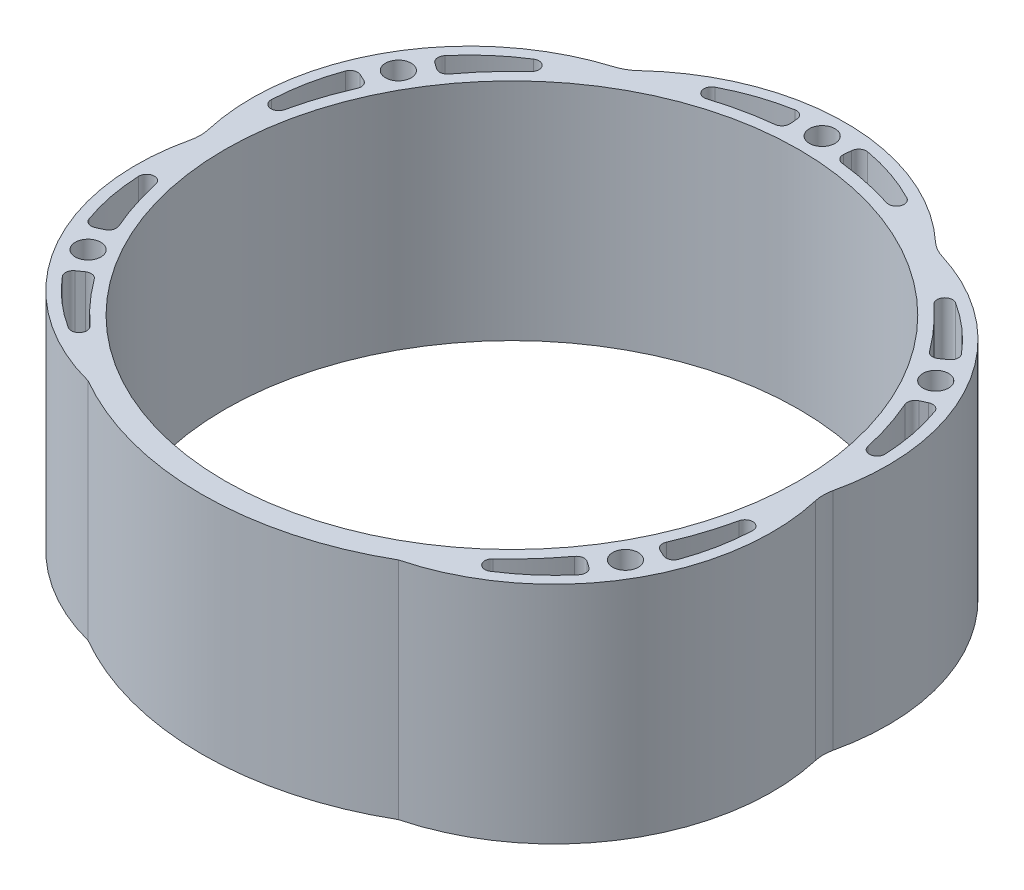
from build123d import *

# Parameters (mm, degrees)
SWEEP_2_DEPTH                   = 3
SKETCH_15_W                     = 3
SKETCH_15_H                     = 8
SKETCH_17_W                     = 3
SKETCH_17_H                     = 8
REVOLVE_1_ANGLE                 = 60
SKETCH_20_R                     = 26.546275206
EXTRUDE_1_DEPTH                 = 3
SKETCH_21_R                     = 12.5
CUT_EXTRUDE_1_DEPTH             = 10
CUT_EXTRUDE_2_REACH             = 67.765
SKETCH_22_R                     = 20
EXTRUDE_START                   = 22
SKETCH_23_R                     = 17
SKETCH_23_R_2                   = 12.5
EXTRUDE_2_DEPTH                 = 22
SKETCH_24_R                     = 55.165528931
CUT_EXTRUDE_3_DEPTH             = 70.166465863
SKETCH_25_R                     = 1.4
CUT_EXTRUDE_4_DEPTH             = 10
SKETCH_26_R                     = 3
EXTRUDE_3_DEPTH                 = 3
SKETCH_27_R                     = 1.65
CUT_EXTRUDE_5_DEPTH             = 3
SKETCH_28_R                     = 37
CUT_EXTRUDE_6_DEPTH             = 10
FILLET_1_R                      = 10
SKETCH_29_W                     = 24
SKETCH_29_H                     = 3
EXTRUDE_4_DEPTH                 = 15
SKETCH_30_R                     = 3
EXTRUDE_5_DEPTH                 = 3
SKETCH_31_R                     = 1.25
CUT_EXTRUDE_7_DEPTH             = 3
CUT_EXTRUDE_START               = -10
SKETCH_32_R                     = 1.25
CUT_EXTRUDE_8_DEPTH             = 10
SKETCH_33_R                     = 37
SKETCH_33_R_2                   = 1.65
EXTRUDE_6_DEPTH                 = 26
FILLET_2_R                      = 2
EXTRUDE_START_2                 = -29
EXTRUDE_7_DEPTH                 = 29
PATTERN_CIRCULAR_3_COUNT        = 3
PATTERN_CIRCULAR_3_ANGLE        = 120
MIRROR_START                    = -29
MIRROR_1_COPY_1_DEPTH           = 29
MIRROR_1_COPY_2_DEPTH           = 29
MIRROR_1_COPY_3_DEPTH           = 29
CUT_EXTRUDE_9_DEPTH             = 67.116367792
PATTERN_CIRCULAR_4_COUNT        = 3
PATTERN_CIRCULAR_4_ANGLE        = 120
PATTERN_CIRCULAR_4_COPY_1_DEPTH = 67.116367792
PATTERN_CIRCULAR_4_COPY_2_DEPTH = 67.116367792
MIRROR_3_COPY_1_DEPTH           = 67.116367792
MIRROR_3_COPY_2_DEPTH           = 67.116367792
MIRROR_3_COPY_3_DEPTH           = 67.116367792
MIRROR_3_COPY_4_DEPTH           = 67.116367792
MIRROR_3_COPY_5_DEPTH           = 67.116367792
FILLET_4_R                      = 1
FILLET_5_R                      = 1
EXTRUDE_8_DEPTH                 = 29
PATTERN_CIRCULAR_5_COUNT        = 3
PATTERN_CIRCULAR_5_ANGLE        = 120
PATTERN_CIRCULAR_5_COPY_1_DEPTH = 29
PATTERN_CIRCULAR_5_COPY_2_DEPTH = 29
F_5_THE_OTHER_WAY_COUNT         = 3
F_5_THE_OTHER_WAY_ANGLE         = 120
F_5_THE_OTHER_WAY_COPY_1_DEPTH  = 29
F_5_THE_OTHER_WAY_COPY_2_DEPTH  = 29
FILLET_6_R                      = 5


# Read off the part's stored shape, not the designer's step: 扫描2
with BuildPart() as part:
    # 扫描2 outline → 扫描2 (new body)
    with BuildSketch(Plane(origin=(0, 0, 0), x_dir=(1, 0, 0), z_dir=(0, 1, 0))):
        with BuildLine():
            ThreePointArc((-20, -34.641016151), (-12.679491924, -41.961524227), (-10, -51.961524227))
            Line((-10, -51.961524227), (11, -51.961524227))
            ThreePointArc((11, -51.961524227), (10.470745096, -45.395034193), (8.896644323, -38.998073283))
            ThreePointArc((8.896644323, -38.998073283), (5.963817028, 39.55291249), (-20, -34.641016151))
        make_face()
        with BuildLine():
            ThreePointArc((0, -24.015147002), (-4.46857992, -19.881209566), (-9.5, -16.454482672))
            ThreePointArc((-9.5, -16.454482672), (4.917561857, 18.352590699), (0, -19))
            Line((0, -19), (0, -24.015147002))
        make_face(mode=Mode.SUBTRACT)
    extrude(amount=SWEEP_2_DEPTH)

    # 扫描3: sweep along a path in 草图16
    with BuildLine(Plane(origin=(0, 3, 0), x_dir=(1, 0, 0), z_dir=(0, 1, 0))) as sweep_3_path:
        ThreePointArc((-10, -51.961524227), (-12.679491924, -41.961524227), (-20, -34.641016151))
        ThreePointArc((-20, -34.641016151), (5.963817027, 39.55291249), (8.896644323, -38.998073283))
    # 草图15 → 扫描3 (sweep)
    with BuildSketch(Plane.XY.offset(51.961524227)):
        with Locations((-8.5, 4)):
            Rectangle(SKETCH_15_W, SKETCH_15_H)
    sweep(path=sweep_3_path.line)

    # 草图17 → 旋转1 (revolve)
    with BuildSketch(Plane.XY.offset(51.961524227)):
        with Locations((12.5, 4)):
            Rectangle(SKETCH_17_W, SKETCH_17_H)
    revolve(axis=Axis((-30, 3, 51.961524227), (0, 1, 0)), revolution_arc=REVOLVE_1_ANGLE)

    # 草图20 → 凸台-拉伸1 (add)
    with BuildSketch(Plane(origin=(0, 3, 0), x_dir=(1, 0, 0), z_dir=(0, 1, 0))):
        Circle(SKETCH_20_R)
    extrude(amount=-EXTRUDE_1_DEPTH)

    # 草图21 → 切除-拉伸1 (cut)
    with BuildSketch(Plane(origin=(0, 3, 0), x_dir=(1, 0, 0), z_dir=(0, 1, 0))):
        with Locations(Location((0, 0, 0), (0, 0, 270))):
            Circle(SKETCH_21_R)
    extrude(amount=-CUT_EXTRUDE_1_DEPTH, mode=Mode.SUBTRACT)

    # 草图22 → 切除-拉伸2 (cut, up to next)
    with BuildSketch(Plane(origin=(0, 3, 0), x_dir=(1, 0, 0), z_dir=(0, 1, 0)), mode=Mode.PRIVATE) as cut_extrude_2_sk1:
        Circle(SKETCH_22_R)
    cut_extrude_2_tool1 = extrude(cut_extrude_2_sk1.sketch, amount=CUT_EXTRUDE_2_REACH, mode=Mode.PRIVATE) & part.part
    add(cut_extrude_2_tool1.solids().sort_by_distance((0, 3, 0))[0], mode=Mode.SUBTRACT)

    # 草图23 → 凸台-拉伸2 (add)
    with BuildSketch(Plane(origin=(0, 3, 0), x_dir=(1, 0, 0), z_dir=(0, 1, 0)).offset(EXTRUDE_START)):
        with Locations(Location((0, 0, 0), (0, 0, 270))):
            Circle(SKETCH_23_R)
        with Locations(Location((0, 0, 0), (0, 0, 270))):
            Circle(SKETCH_23_R_2, mode=Mode.SUBTRACT)
    extrude(amount=-EXTRUDE_2_DEPTH)

    # 草图24 → 切除-拉伸3 (cut, through all)
    with BuildSketch(Plane(origin=(0, 3, 0), x_dir=(1, 0, 0), z_dir=(0, 1, 0))):
        Circle(SKETCH_24_R)
    extrude(amount=CUT_EXTRUDE_3_DEPTH, mode=Mode.SUBTRACT)

    # 草图25 → 切除-拉伸4 (cut)
    with BuildSketch(Plane(origin=(0, 3, 0), x_dir=(1, 0, 0), z_dir=(0, 1, 0))):
        with Locations(Location((0, -14.75, 0), (0, 0, 270))):
            Circle(SKETCH_25_R)
        with Locations(Location((-12.773874706, 7.375, 0), (0, 0, 270))):
            Circle(SKETCH_25_R)
        with Locations(Location((12.773874706, 7.375, 0), (0, 0, 270))):
            Circle(SKETCH_25_R)
    extrude(amount=-CUT_EXTRUDE_4_DEPTH, mode=Mode.SUBTRACT)

    # 草图26 → 凸台-拉伸3 (add)
    with BuildSketch(Plane(origin=(0, 3, 0), x_dir=(1, 0, 0), z_dir=(0, 1, 0))):
        with Locations((0, 40)):
            Circle(SKETCH_26_R)
        with Locations((34.641016151, 20)):
            Circle(SKETCH_26_R)
        with Locations((34.641016151, -20)):
            Circle(SKETCH_26_R)
        with Locations((0, -40)):
            Circle(SKETCH_26_R)
        with Locations((-34.641016151, -20)):
            Circle(SKETCH_26_R)
        with Locations((-34.641016151, 20)):
            Circle(SKETCH_26_R)
    extrude(amount=-EXTRUDE_3_DEPTH)

    # 草图27 → 切除-拉伸5 (cut)
    with BuildSketch(Plane(origin=(0, 3, 0), x_dir=(1, 0, 0), z_dir=(0, 1, 0))):
        with Locations(Location((0, 40, 0), (0, 0, 270))):
            Circle(SKETCH_27_R)
        with Locations(Location((34.641016151, 20, 0), (0, 0, 270))):
            Circle(SKETCH_27_R)
        with Locations(Location((34.641016151, -20, 0), (0, 0, 270))):
            Circle(SKETCH_27_R)
        with Locations(Location((-34.641016151, -20, 0), (0, 0, 270))):
            Circle(SKETCH_27_R)
        with Locations(Location((-34.641016151, 20, 0), (0, 0, 270))):
            Circle(SKETCH_27_R)
    extrude(amount=-CUT_EXTRUDE_5_DEPTH, mode=Mode.SUBTRACT)

    # 草图28 → 切除-拉伸6 (cut)
    with BuildSketch(Plane.XZ):
        with Locations(Location((0, 0, 0), (0, 0, 270))):
            Circle(SKETCH_28_R)
    extrude(amount=-CUT_EXTRUDE_6_DEPTH, mode=Mode.SUBTRACT)

    # 圆角1
    fillet_1_edges = [part.edges().sort_by_distance(p)[0] for p in [
        (11.799212586, 1.5, 38.220133207),
    ]]
    fillet(fillet_1_edges, radius=FILLET_1_R)

    # 草图29 → 凸台-拉伸4 (add)
    with BuildSketch(Plane.XY.offset(51.961524227)):
        with Locations((2, 1.5)):
            Rectangle(SKETCH_29_W, SKETCH_29_H)
    extrude(amount=EXTRUDE_4_DEPTH)

    # 草图30 → 凸台-拉伸5 (add)
    with BuildSketch(Plane.XZ):
        with Locations((-10, 54.961524227)):
            Circle(SKETCH_30_R)
        with Locations((14, 54.961524227)):
            Circle(SKETCH_30_R)
    extrude(amount=-EXTRUDE_5_DEPTH)

    # 草图31 → 切除-拉伸7 (cut)
    with BuildSketch(Plane.XZ):
        with Locations(Location((14, 54.961524227, 0), (0, 0, 270))):
            Circle(SKETCH_31_R)
        with Locations(Location((-10, 54.961524227, 0), (0, 0, 270))):
            Circle(SKETCH_31_R)
    extrude(amount=-CUT_EXTRUDE_7_DEPTH, mode=Mode.SUBTRACT)

    # 草图32 → 切除-拉伸8 (cut)
    with BuildSketch(Plane(origin=(0, 3, 0), x_dir=(1, 0, 0), z_dir=(0, 1, 0)).offset(CUT_EXTRUDE_START)):
        with BuildLine():
            Line((-10, -66.961524227), (14, -66.961524227))
            Line((14, -66.961524227), (14, -57.961524227))
            ThreePointArc((14, -57.961524227), (17, -54.961524227), (14, -51.961524227))
            ThreePointArc((14, -51.961524227), (13.884685063, -48.778064325), (13.539344684, -45.611290809))
            ThreePointArc((13.539344684, -45.611290809), (14.514796568, -39.647413342), (18.747720235, -35.334444753))
            ThreePointArc((18.747720235, -35.334444753), (-0.715724778, -39.993596213), (-20, -34.641016151))
            ThreePointArc((-20, -34.641016151), (-12.679491924, -41.961524227), (-10, -51.961524227))
            ThreePointArc((-10, -51.961524227), (-13, -54.961524227), (-10, -57.961524227))
            Line((-10, -57.961524227), (-10, -66.961524227))
        make_face()
        with Locations((-10, -54.961524227)):
            Circle(SKETCH_32_R, mode=Mode.SUBTRACT)
        with Locations((14, -54.961524227)):
            Circle(SKETCH_32_R, mode=Mode.SUBTRACT)
    extrude(amount=CUT_EXTRUDE_8_DEPTH, mode=Mode.SUBTRACT)

    # 草图33 → 凸台-拉伸6 (add)
    with BuildSketch(Plane(origin=(0, 3, 0), x_dir=(1, 0, 0), z_dir=(0, 1, 0))):
        with BuildLine():
            ThreePointArc((-33.044643352, -22.539998796), (0, -40), (33.044643352, -22.539998796))
            ThreePointArc((33.044643352, -22.539998796), (37.239092363, -21.5), (36.042533235, -17.347501204))
            ThreePointArc((36.042533235, -17.347501204), (40, 0), (36.042533235, 17.347501204))
            ThreePointArc((36.042533235, 17.347501204), (37.239092363, 21.5), (33.044643352, 22.539998796))
            ThreePointArc((33.044643352, 22.539998796), (20, 34.641016151), (2.997889883, 39.8875))
            ThreePointArc((2.997889883, 39.8875), (0, 43), (-2.997889883, 39.8875))
            ThreePointArc((-2.997889883, 39.8875), (-20, 34.641016151), (-33.044643352, 22.539998796))
            ThreePointArc((-33.044643352, 22.539998796), (-37.239092363, 21.5), (-36.042533235, 17.347501204))
            ThreePointArc((-36.042533235, 17.347501204), (-40, 0), (-36.042533235, -17.347501204))
            ThreePointArc((-36.042533235, -17.347501204), (-37.239092363, -21.5), (-33.044643352, -22.539998796))
        make_face()
        with Locations(Location((0, 0, 0), (0, 0, 90))):
            Circle(SKETCH_33_R, mode=Mode.SUBTRACT)
        with Locations(Location((-34.641016151, -20, 0), (0, 0, 270))):
            Circle(SKETCH_33_R_2, mode=Mode.SUBTRACT)
        with Locations(Location((34.641016151, -20, 0), (0, 0, 270))):
            Circle(SKETCH_33_R_2, mode=Mode.SUBTRACT)
        with Locations(Location((0, 40, 0), (0, 0, 270))):
            Circle(SKETCH_33_R_2, mode=Mode.SUBTRACT)
        with Locations(Location((34.641016151, 20, 0), (0, 0, 270))):
            Circle(SKETCH_33_R_2, mode=Mode.SUBTRACT)
        with Locations(Location((-34.641016151, 20, 0), (0, 0, 270))):
            Circle(SKETCH_33_R_2, mode=Mode.SUBTRACT)
    extrude(amount=EXTRUDE_6_DEPTH)

    # 圆角2
    fillet_2_edges = [part.edges().sort_by_distance(p)[0] for p in [
        (33.044643352, 16, -22.539998796),
        (36.042533235, 16, -17.347501204),
        (36.042533235, 16, 17.347501204),
        (33.044643352, 16, 22.539998796),
        (-2.997889883, 16, -39.8875),
        (2.997889883, 16, -39.8875),
        (-36.042533235, 16, -17.347501204),
        (-33.044643352, 16, -22.539998796),
        (-33.044643352, 16, 22.539998796),
        (-36.042533235, 16, 17.347501204),
    ]]
    fillet(fillet_2_edges, radius=FILLET_2_R)

    # 草图34 → 凸台-拉伸7 (add)
    with BuildSketch(Plane(origin=(0, 29, 0), x_dir=(1, 0, 0), z_dir=(0, 1, 0)).offset(EXTRUDE_START_2)):
        with BuildLine():
            ThreePointArc((2.7e-08, 43), (-10.838272578, 40.826188689), (-20, 34.641016151))
            ThreePointArc((-20, 34.641016151), (-12.496448765, 37.997878471), (-4.465142775, 39.75))
            ThreePointArc((-4.465142775, 39.75), (-3.456049517, 40.162281761), (-2.813039948, 41.0425))
            ThreePointArc((-2.813039948, 41.0425), (-1.713548938, 42.462468282), (2.7e-08, 43))
        make_face()
        with BuildLine():
            ThreePointArc((4.465142775, 39.75), (12.496448765, 37.997878471), (20, 34.641016151))
            ThreePointArc((20, 34.641016151), (10.838272603, 40.826188679), (2.7e-08, 43))
            ThreePointArc((2.7e-08, 43), (1.71354896, 42.462468266), (2.813039948, 41.0425))
            ThreePointArc((2.813039948, 41.0425), (3.456049517, 40.162281761), (4.465142775, 39.75))
        make_face()
    extrude_7 = extrude(amount=EXTRUDE_7_DEPTH)

    # 阵列(圆周)3: 凸台-拉伸7 ×3 about axis
    pattern_circular_3_axis = Axis((0, 0, 0), (0, 1, 0))
    for i in range(1, PATTERN_CIRCULAR_3_COUNT):
        add(extrude_7.rotate(pattern_circular_3_axis, i * PATTERN_CIRCULAR_3_ANGLE / (PATTERN_CIRCULAR_3_COUNT - 1)))

    # 镜向1 copy 1 sketch → 镜向1 copy 1 (add)
    with BuildSketch(Plane(origin=(0, 29, 0), x_dir=(-0.499999999999998, 0, -0.8660254037844398), z_dir=(0, 1, 0)).offset(MIRROR_START)):
        with BuildLine():
            ThreePointArc((2.7e-08, -43), (-10.838272578, -40.826188689), (-20, -34.641016151))
            ThreePointArc((-20, -34.641016151), (-12.496448765, -37.997878471), (-4.465142775, -39.75))
            ThreePointArc((-4.465142775, -39.75), (-3.456049517, -40.162281761), (-2.813039948, -41.0425))
            ThreePointArc((-2.813039948, -41.0425), (-1.713548938, -42.462468282), (2.7e-08, -43))
        make_face()
        with BuildLine():
            ThreePointArc((4.465142775, -39.75), (12.496448765, -37.997878471), (20, -34.641016151))
            ThreePointArc((20, -34.641016151), (10.838272603, -40.826188679), (2.7e-08, -43))
            ThreePointArc((2.7e-08, -43), (1.71354896, -42.462468266), (2.813039948, -41.0425))
            ThreePointArc((2.813039948, -41.0425), (3.456049517, -40.162281761), (4.465142775, -39.75))
        make_face()
    extrude(amount=MIRROR_1_COPY_1_DEPTH)

    # 镜向1 copy 2 sketch → 镜向1 copy 2 (add)
    with BuildSketch(Plane(origin=(0, 29, 0), x_dir=(0.500000000000004, 0, -0.8660254037844363), z_dir=(0, 1, 0)).offset(MIRROR_START)):
        with BuildLine():
            ThreePointArc((2.7e-08, -43), (-10.838272578, -40.826188689), (-20, -34.641016151))
            ThreePointArc((-20, -34.641016151), (-12.496448765, -37.997878471), (-4.465142775, -39.75))
            ThreePointArc((-4.465142775, -39.75), (-3.456049517, -40.162281761), (-2.813039948, -41.0425))
            ThreePointArc((-2.813039948, -41.0425), (-1.713548938, -42.462468282), (2.7e-08, -43))
        make_face()
        with BuildLine():
            ThreePointArc((4.465142775, -39.75), (12.496448765, -37.997878471), (20, -34.641016151))
            ThreePointArc((20, -34.641016151), (10.838272603, -40.826188679), (2.7e-08, -43))
            ThreePointArc((2.7e-08, -43), (1.71354896, -42.462468266), (2.813039948, -41.0425))
            ThreePointArc((2.813039948, -41.0425), (3.456049517, -40.162281761), (4.465142775, -39.75))
        make_face()
    extrude(amount=MIRROR_1_COPY_2_DEPTH)

    # 镜向1 copy 3 sketch → 镜向1 copy 3 (add)
    with BuildSketch(Plane(origin=(0, 29, 0), x_dir=(-1, 0, 0), z_dir=(0, 1, 0)).offset(MIRROR_START)):
        with BuildLine():
            ThreePointArc((2.7e-08, -43), (-10.838272578, -40.826188689), (-20, -34.641016151))
            ThreePointArc((-20, -34.641016151), (-12.496448765, -37.997878471), (-4.465142775, -39.75))
            ThreePointArc((-4.465142775, -39.75), (-3.456049517, -40.162281761), (-2.813039948, -41.0425))
            ThreePointArc((-2.813039948, -41.0425), (-1.713548938, -42.462468282), (2.7e-08, -43))
        make_face()
        with BuildLine():
            ThreePointArc((4.465142775, -39.75), (12.496448765, -37.997878471), (20, -34.641016151))
            ThreePointArc((20, -34.641016151), (10.838272603, -40.826188679), (2.7e-08, -43))
            ThreePointArc((2.7e-08, -43), (1.71354896, -42.462468266), (2.813039948, -41.0425))
            ThreePointArc((2.813039948, -41.0425), (3.456049517, -40.162281761), (4.465142775, -39.75))
        make_face()
    extrude(amount=MIRROR_1_COPY_3_DEPTH)

    # 草图35 → 切除-拉伸9 (cut, through all)
    with BuildSketch(Plane(origin=(0, 29, 0), x_dir=(1, 0, 0), z_dir=(0, 1, 0))):
        with BuildLine():
            ThreePointArc((-16.270803077, 34.892849801), (-9.964533236, 37.188144312), (-3.355496096, 38.353495877))
            Line((-3.355496096, 38.353495877), (-3.616963324, 41.342079971))
            ThreePointArc((-3.616963324, 41.342079971), (-10.52155438, 39.427235786), (-16.668082722, 35.744818749))
            Line((-16.668082722, 35.744818749), (-16.270803077, 34.892849801))
        make_face()
    cut_extrude_9 = extrude(amount=-CUT_EXTRUDE_9_DEPTH, mode=Mode.SUBTRACT)

    # 镜向2: 切除-拉伸9 across plane
    add(cut_extrude_9.mirror(Plane(origin=(0, 0, 0), x_dir=(0, 0, 1), z_dir=(1, 0, 0))), mode=Mode.SUBTRACT)

    # 阵列(圆周)4: 切除-拉伸9 ×3 about axis
    pattern_circular_4_axis = Axis((0, 0, 0), (0, 1, 0))
    for i in range(1, PATTERN_CIRCULAR_4_COUNT):
        add(cut_extrude_9.rotate(pattern_circular_4_axis, i * PATTERN_CIRCULAR_4_ANGLE / (PATTERN_CIRCULAR_4_COUNT - 1)), mode=Mode.SUBTRACT)

    # 阵列(圆周)4 copy 1 sketch → 阵列(圆周)4 copy 1 (cut, through all)
    with BuildSketch(Plane(origin=(0, 29, 0), x_dir=(-0.4999999999999978, 0, 0.8660254037844399), z_dir=(0, 1, 0))):
        with BuildLine():
            ThreePointArc((-16.270803077, -34.892849801), (-9.964533236, -37.188144312), (-3.355496096, -38.353495877))
            Line((-3.355496096, -38.353495877), (-3.616963324, -41.342079971))
            ThreePointArc((-3.616963324, -41.342079971), (-10.52155438, -39.427235786), (-16.668082722, -35.744818749))
            Line((-16.668082722, -35.744818749), (-16.270803077, -34.892849801))
        make_face()
    extrude(amount=-PATTERN_CIRCULAR_4_COPY_1_DEPTH, mode=Mode.SUBTRACT)

    # 阵列(圆周)4 copy 2 sketch → 阵列(圆周)4 copy 2 (cut, through all)
    with BuildSketch(Plane(origin=(0, 29, 0), x_dir=(0.5000000000000044, 0, 0.866025403784436), z_dir=(0, 1, 0))):
        with BuildLine():
            ThreePointArc((-16.270803077, -34.892849801), (-9.964533236, -37.188144312), (-3.355496096, -38.353495877))
            Line((-3.355496096, -38.353495877), (-3.616963324, -41.342079971))
            ThreePointArc((-3.616963324, -41.342079971), (-10.52155438, -39.427235786), (-16.668082722, -35.744818749))
            Line((-16.668082722, -35.744818749), (-16.270803077, -34.892849801))
        make_face()
    extrude(amount=-PATTERN_CIRCULAR_4_COPY_2_DEPTH, mode=Mode.SUBTRACT)

    # 镜向3 copy 1 sketch → 镜向3 copy 1 (cut, through all)
    with BuildSketch(Plane(origin=(0, 29, 0), x_dir=(-0.4999999999999978, 0, -0.8660254037844399), z_dir=(0, 1, 0))):
        with BuildLine():
            ThreePointArc((-16.270803077, -34.892849801), (-9.964533236, -37.188144312), (-3.355496096, -38.353495877))
            Line((-3.355496096, -38.353495877), (-3.616963324, -41.342079971))
            ThreePointArc((-3.616963324, -41.342079971), (-10.52155438, -39.427235786), (-16.668082722, -35.744818749))
            Line((-16.668082722, -35.744818749), (-16.270803077, -34.892849801))
        make_face()
    extrude(amount=-MIRROR_3_COPY_1_DEPTH, mode=Mode.SUBTRACT)

    # 镜向3 copy 2 sketch → 镜向3 copy 2 (cut, through all)
    with BuildSketch(Plane(origin=(0, 29, 0), x_dir=(0.5000000000000044, 0, -0.866025403784436), z_dir=(0, 1, 0))):
        with BuildLine():
            ThreePointArc((-16.270803077, -34.892849801), (-9.964533236, -37.188144312), (-3.355496096, -38.353495877))
            Line((-3.355496096, -38.353495877), (-3.616963324, -41.342079971))
            ThreePointArc((-3.616963324, -41.342079971), (-10.52155438, -39.427235786), (-16.668082722, -35.744818749))
            Line((-16.668082722, -35.744818749), (-16.270803077, -34.892849801))
        make_face()
    extrude(amount=-MIRROR_3_COPY_2_DEPTH, mode=Mode.SUBTRACT)

    # 镜向3 copy 3 sketch → 镜向3 copy 3 (cut, through all)
    with BuildSketch(Plane(origin=(0, 29, 0), x_dir=(0.4999999999999978, 0, 0.8660254037844399), z_dir=(0, 1, 0))):
        with BuildLine():
            ThreePointArc((-16.270803077, 34.892849801), (-9.964533236, 37.188144312), (-3.355496096, 38.353495877))
            Line((-3.355496096, 38.353495877), (-3.616963324, 41.342079971))
            ThreePointArc((-3.616963324, 41.342079971), (-10.52155438, 39.427235786), (-16.668082722, 35.744818749))
            Line((-16.668082722, 35.744818749), (-16.270803077, 34.892849801))
        make_face()
    extrude(amount=-MIRROR_3_COPY_3_DEPTH, mode=Mode.SUBTRACT)

    # 镜向3 copy 4 sketch → 镜向3 copy 4 (cut, through all)
    with BuildSketch(Plane(origin=(0, 29, 0), x_dir=(-0.5000000000000044, 0, 0.866025403784436), z_dir=(0, 1, 0))):
        with BuildLine():
            ThreePointArc((-16.270803077, 34.892849801), (-9.964533236, 37.188144312), (-3.355496096, 38.353495877))
            Line((-3.355496096, 38.353495877), (-3.616963324, 41.342079971))
            ThreePointArc((-3.616963324, 41.342079971), (-10.52155438, 39.427235786), (-16.668082722, 35.744818749))
            Line((-16.668082722, 35.744818749), (-16.270803077, 34.892849801))
        make_face()
    extrude(amount=-MIRROR_3_COPY_4_DEPTH, mode=Mode.SUBTRACT)

    # 镜向3 copy 5 sketch → 镜向3 copy 5 (cut, through all)
    with BuildSketch(Plane(origin=(0, 29, 0), x_dir=(-1, 0, 0), z_dir=(0, 1, 0))):
        with BuildLine():
            ThreePointArc((-16.270803077, -34.892849801), (-9.964533236, -37.188144312), (-3.355496096, -38.353495877))
            Line((-3.355496096, -38.353495877), (-3.616963324, -41.342079971))
            ThreePointArc((-3.616963324, -41.342079971), (-10.52155438, -39.427235786), (-16.668082722, -35.744818749))
            Line((-16.668082722, -35.744818749), (-16.270803077, -34.892849801))
        make_face()
    extrude(amount=-MIRROR_3_COPY_5_DEPTH, mode=Mode.SUBTRACT)

    # 圆角4
    # the kernel refuses this fillet: 1 mm, written as the material it adds along each edge
    with BuildSketch(Plane(origin=(34.892849801, 29, 16.270803077), x_dir=(0.4111112269100741, 0, -0.9115851902639125), z_dir=(0, -1, 0)), Plane(origin=(31.537353705, 29, -22.0826928), x_dir=(-0.5839003190271824, 0, -0.811825361417069), z_dir=(0, -1, 0)), Plane(origin=(-3.355496096, 29, -38.353495877), x_dir=(-0.9950115459372554, 0, 0.09975982884685211), z_dir=(0, -1, 0))) as fillet_4_piece_1:
        with BuildLine():
            CenterArc((0.987420896, 0.999919869), FILLET_4_R, 180.725340527, 88.549318946)
            Line((-0.012498973, 0.987260626), (0, 0))
            ThreePointArc((0, 0), (0.487380827, 0.00308506), (0.974761653, 0))
        make_face()
    extrude(amount=29)
    with BuildSketch(Plane(origin=(37.611773162, 29, 17.538657862), x_dir=(-0.9063077870366464, 0, -0.4226182617407072), z_dir=(0, -1, 0))) as fillet_4_piece_2:
        with BuildLine():
            CenterArc((1.071397567, 1), FILLET_4_R, 174.86854017, 95.13145983)
            ThreePointArc((0.075405462, 1.089441187), (0.03213106, 0.545106236), (0, 0))
            Line((0, 0), (1.071397567, 0))
        make_face()
    extrude(amount=29)
    with BuildSketch(Plane(origin=(39.289962451, 29, 3.437426305), x_dir=(-0.996194698091714, 0, -0.0871557427480193), z_dir=(0, -1, 0)), Plane(origin=(22.621879729, 29, -32.307392444), x_dir=(-0.5735764363513369, 0, 0.8191520442887881), z_dir=(0, -1, 0)), Plane(origin=(-16.668082722, 29, -35.744818749), x_dir=(0.422618261740378, 0, 0.9063077870367998), z_dir=(0, -1, 0))) as fillet_4_piece_3:
        with BuildLine():
            CenterArc((0.798666678, -1), FILLET_4_R, 90, 78.108408666)
            ThreePointArc((-0.179872559, -0.793939422), (-0.09296294, -0.396284), (0, 0))
            Line((0, 0), (0.798666678, 0))
        make_face()
    extrude(amount=29)
    with BuildSketch(Plane(origin=(38.353495877, 29, 3.355496096), x_dir=(0.9961946980917556, 0, 0.0871557427475427), z_dir=(0, -1, 0)), Plane(origin=(34.892849801, 29, -16.270803077), x_dir=(0.9063077870368025, 0, -0.42261826174037226), z_dir=(0, -1, 0)), Plane(origin=(22.0826928, 29, -31.537353705), x_dir=(0.5735764363509456, 0, -0.8191520442890622), z_dir=(0, -1, 0)), Plane(origin=(3.355496096, 29, -38.353495877), x_dir=(0.08715574274801094, 0, -0.9961946980917147), z_dir=(0, -1, 0)), Plane(origin=(-16.270803077, 29, -34.892849801), x_dir=(-0.4226182617408088, 0, -0.906307787036599), z_dir=(0, -1, 0))) as fillet_4_piece_4:
        with BuildLine():
            CenterArc((0.987339743, 1), FILLET_4_R, 181.450681054, 88.549318946)
            ThreePointArc((-0.012339744, 0.974683544), (-0.00308506, 0.487380827), (0, 0))
            Line((0, 0), (0.987339743, 0))
        make_face()
    extrude(amount=29)
    with BuildSketch(Plane(origin=(38.353495877, 29, -3.355496096), x_dir=(0.996194698091756, 0, -0.08715574274753815), z_dir=(0, -1, 0)), Plane(origin=(16.270803077, 29, -34.892849801), x_dir=(0.4226182617408088, 0, -0.906307787036599), z_dir=(0, -1, 0))) as fillet_4_piece_5:
        with BuildLine():
            CenterArc((0.987339743, -1), FILLET_4_R, 90, 88.549318946)
            ThreePointArc((-0.012339744, -0.974683544), (-0.00308506, -0.487380827), (0, 0))
            Line((0, 0), (0.987339743, 0))
        make_face()
    extrude(amount=29)
    with BuildSketch(Plane(origin=(39.289962451, 29, -3.437426305), x_dir=(0.1351149644883606, 0, -0.9908299280761098), z_dir=(0, -1, 0)), Plane(origin=(16.668082722, 29, -35.744818749), x_dir=(-0.7905264062996429, 0, -0.6124279557164026), z_dir=(0, -1, 0))) as fillet_4_piece_6:
        with BuildLine():
            CenterArc((0.79881222, -0.999883743), FILLET_4_R, 89.126323556, 78.108408666)
            Line((-0.176471256, -0.778926414), (0, 0))
            ThreePointArc((0, 0), (0.40703008, 0.003103365), (0.814060159, 0))
        make_face()
    extrude(amount=29)
    with BuildSketch(Plane(origin=(37.611773162, 29, -17.538657862), x_dir=(0.3590293714278442, 0, 0.9333262615249435), z_dir=(0, -1, 0)), Plane(origin=(3.616963324, 29, -41.342079971), x_dir=(0.9877989382136828, 0, 0.15573457440119326), z_dir=(0, -1, 0))) as fillet_4_piece_7:
        with BuildLine():
            CenterArc((1.071592809, 0.999790778), FILLET_4_R, 176.040598366, 95.13145983)
            Line((0.073979581, 1.068840385), (0, 0))
            ThreePointArc((0, 0), (0.546023828, -0.005585001), (1.092047657, 0))
        make_face()
    extrude(amount=29)
    with BuildSketch(Plane(origin=(33.994809838, 29, -23.803422109), x_dir=(-0.628769566785826, 0, -0.7775916871237533), z_dir=(0, -1, 0)), Plane(origin=(-3.616963324, 29, -41.342079971), x_dir=(-0.9877989382136828, 0, 0.15573457440119326), z_dir=(0, -1, 0))) as fillet_4_piece_8:
        with BuildLine():
            CenterArc((1.071592809, -0.999790778), FILLET_4_R, 88.827941804, 95.13145983)
            Line((0.073979581, -1.068840385), (0, 0))
            ThreePointArc((0, 0), (0.546023828, 0.005585001), (1.092047657, 0))
        make_face()
    extrude(amount=29)

    # 圆角5
    # the kernel refuses this fillet: 1 mm, written as the material it adds along each edge
    with BuildSketch(Plane(origin=(-33.994809838, 29, -23.803422109), x_dir=(0.8191520442889973, 0, 0.5735764363510382), z_dir=(0, -1, 0)), Plane(origin=(-37.611773162, 29, 17.538657862), x_dir=(0.9063077870366464, 0, -0.4226182617407072), z_dir=(0, -1, 0)), Plane(origin=(33.994809838, 29, 23.803422109), x_dir=(-0.819152044288992, 0, -0.5735764363510457), z_dir=(0, -1, 0))) as fillet_5_piece_1:
        with BuildLine():
            CenterArc((1.071397567, -1), FILLET_5_R, 90, 95.13145983)
            ThreePointArc((0.075405462, -1.089441187), (0.03213106, -0.545106236), (0, 0))
            Line((0, 0), (1.071397567, 0))
        make_face()
    extrude(amount=29)
    with BuildSketch(Plane(origin=(-31.537353705, 29, -22.0826928), x_dir=(-0.8191520442887896, 0, -0.5735764363513348), z_dir=(0, -1, 0)), Plane(origin=(-38.353495877, 29, -3.355496096), x_dir=(-0.996194698091756, 0, -0.08715574274753815), z_dir=(0, -1, 0)), Plane(origin=(-22.0826928, 29, 31.537353705), x_dir=(-0.5735764363509417, 0, 0.819152044289065), z_dir=(0, -1, 0)), Plane(origin=(31.537353705, 29, 22.0826928), x_dir=(0.8191520442887844, 0, 0.5735764363513423), z_dir=(0, -1, 0))) as fillet_5_piece_2:
        with BuildLine():
            CenterArc((0.987339743, 1), FILLET_5_R, 181.450681054, 88.549318946)
            ThreePointArc((-0.012339744, 0.974683544), (-0.00308506, 0.487380827), (0, 0))
            Line((0, 0), (0.987339743, 0))
        make_face()
    extrude(amount=29)
    with BuildSketch(Plane(origin=(-22.0826928, 29, -31.537353705), x_dir=(-0.8118253614170554, 0, 0.5839003190272012), z_dir=(0, -1, 0)), Plane(origin=(-38.353495877, 29, 3.355496096), x_dir=(0.09975982884686756, 0, 0.9950115459372537), z_dir=(0, -1, 0)), Plane(origin=(-31.537353705, 29, 22.0826928), x_dir=(0.5839003190271931, 0, 0.8118253614170612), z_dir=(0, -1, 0)), Plane(origin=(22.0826928, 29, 31.537353705), x_dir=(0.8118253614170562, 0, -0.5839003190272002), z_dir=(0, -1, 0))) as fillet_5_piece_3:
        with BuildLine():
            CenterArc((0.987420896, 0.999919869), FILLET_5_R, 180.725340527, 88.549318946)
            Line((-0.012498973, 0.987260626), (0, 0))
            ThreePointArc((0, 0), (0.487380827, 0.00308506), (0.974761653, 0))
        make_face()
    extrude(amount=29)
    with BuildSketch(Plane(origin=(-22.621879729, 29, -32.307392444), x_dir=(-0.9256413707879981, 0, 0.37840197235970596), z_dir=(0, -1, 0)), Plane(origin=(22.621879729, 29, 32.307392444), x_dir=(0.9256413707880012, 0, -0.37840197235969847), z_dir=(0, -1, 0))) as fillet_5_piece_4:
        with BuildLine():
            CenterArc((0.79881222, -0.999883743), FILLET_5_R, 89.126323556, 78.108408666)
            Line((-0.176471256, -0.778926414), (0, 0))
            ThreePointArc((0, 0), (0.40703008, 0.003103365), (0.814060159, 0))
        make_face()
    extrude(amount=29)
    with BuildSketch(Plane(origin=(-34.892849801, 29, -16.270803077), x_dir=(-0.9063077870368025, 0, -0.42261826174037226), z_dir=(0, -1, 0))) as fillet_5_piece_5:
        with BuildLine():
            CenterArc((0.987339743, -1), FILLET_5_R, 90, 88.549318946)
            ThreePointArc((-0.012339744, -0.974683544), (-0.00308506, -0.487380827), (0, 0))
            Line((0, 0), (0.987339743, 0))
        make_face()
    extrude(amount=29)
    with BuildSketch(Plane(origin=(-37.611773162, 29, -17.538657862), x_dir=(-0.3590293714278442, 0, 0.9333262615249435), z_dir=(0, -1, 0)), Plane(origin=(-33.994809838, 29, 23.803422109), x_dir=(0.6287695667858416, 0, 0.7775916871237403), z_dir=(0, -1, 0))) as fillet_5_piece_6:
        with BuildLine():
            CenterArc((1.071592809, -0.999790778), FILLET_5_R, 88.827941804, 95.13145983)
            Line((0.073979581, -1.068840385), (0, 0))
            ThreePointArc((0, 0), (0.546023828, 0.005585001), (1.092047657, 0))
        make_face()
    extrude(amount=29)
    with BuildSketch(Plane(origin=(-39.289962451, 29, -3.437426305), x_dir=(-0.1351149644883606, 0, -0.9908299280761098), z_dir=(0, -1, 0))) as fillet_5_piece_7:
        with BuildLine():
            CenterArc((0.79881222, 0.999883743), FILLET_5_R, 192.765267778, 78.108408666)
            Line((-0.176471256, 0.778926414), (0, 0))
            ThreePointArc((0, 0), (0.40703008, -0.003103365), (0.814060159, 0))
        make_face()
    extrude(amount=29)
    with BuildSketch(Plane(origin=(-39.289962451, 29, 3.437426305), x_dir=(0.996194698091714, 0, -0.0871557427480193), z_dir=(0, -1, 0))) as fillet_5_piece_8:
        with BuildLine():
            CenterArc((0.798666678, 1), FILLET_5_R, 191.891591334, 78.108408666)
            ThreePointArc((-0.179872559, 0.793939422), (-0.09296294, 0.396284), (0, 0))
            Line((0, 0), (0.798666678, 0))
        make_face()
    extrude(amount=29)
    with BuildSketch(Plane(origin=(-34.892849801, 29, 16.270803077), x_dir=(-0.41111122691007546, 0, -0.9115851902639119), z_dir=(0, -1, 0))) as fillet_5_piece_9:
        with BuildLine():
            CenterArc((0.987420896, -0.999919869), FILLET_5_R, 90.725340527, 88.549318946)
            Line((-0.012498973, -0.987260626), (0, 0))
            ThreePointArc((0, 0), (0.487380827, -0.00308506), (0.974761653, 0))
        make_face()
    extrude(amount=29)
    with BuildSketch(Plane(origin=(-22.621879729, 29, 32.307392444), x_dir=(0.5735764363513319, 0, -0.8191520442887917), z_dir=(0, -1, 0))) as fillet_5_piece_10:
        with BuildLine():
            CenterArc((0.798666678, -1), FILLET_5_R, 90, 78.108408666)
            ThreePointArc((-0.179872559, -0.793939422), (-0.09296294, -0.396284), (0, 0))
            Line((0, 0), (0.798666678, 0))
        make_face()
    extrude(amount=29)

    # 草图37 → 凸台-拉伸8 (add)
    with BuildSketch(Plane(origin=(0, 29, 0), x_dir=(1, 0, 0), z_dir=(0, 1, 0))):
        with BuildLine():
            ThreePointArc((-15.38222479, 35.29358526), (-13.512798986, 36.050717934), (-11.6062876, 36.708910201))
            ThreePointArc((-11.6062876, 36.708910201), (-12.831110935, 37.278456201), (-12.371192476, 38.548515199))
            ThreePointArc((-12.371192476, 38.548515199), (-14.244575169, 37.469965909), (-16.02454667, 36.243371948))
            ThreePointArc((-16.02454667, 36.243371948), (-16.318666076, 35.89082263), (-16.424243732, 35.44399984))
            ThreePointArc((-16.424243732, 35.44399984), (-15.924631498, 35.220560067), (-15.38222479, 35.29358526))
        make_face()
    extrude_8 = extrude(amount=-EXTRUDE_8_DEPTH)

    # 镜向4: 凸台-拉伸8 across plane
    add(extrude_8.mirror(Plane(origin=(0, 0, 0), x_dir=(0, 0, 1), z_dir=(1, 0, 0))))

    # 阵列(圆周)5: 凸台-拉伸8 ×3 about axis
    pattern_circular_5_axis = Axis((0, 0, 0), (0, 1, 0))
    for i in range(1, PATTERN_CIRCULAR_5_COUNT):
        add(extrude_8.rotate(pattern_circular_5_axis, i * PATTERN_CIRCULAR_5_ANGLE / (PATTERN_CIRCULAR_5_COUNT - 1)))

    # 阵列(圆周)5 copy 1 sketch → 阵列(圆周)5 copy 1 (add)
    with BuildSketch(Plane(origin=(0, 29, 0), x_dir=(-0.4999999999999978, 0, 0.8660254037844399), z_dir=(0, 1, 0))):
        with BuildLine():
            ThreePointArc((-15.38222479, -35.29358526), (-13.512798986, -36.050717934), (-11.6062876, -36.708910201))
            ThreePointArc((-11.6062876, -36.708910201), (-12.831110935, -37.278456201), (-12.371192476, -38.548515199))
            ThreePointArc((-12.371192476, -38.548515199), (-14.244575169, -37.469965909), (-16.02454667, -36.243371948))
            ThreePointArc((-16.02454667, -36.243371948), (-16.318666076, -35.89082263), (-16.424243732, -35.44399984))
            ThreePointArc((-16.424243732, -35.44399984), (-15.924631498, -35.220560067), (-15.38222479, -35.29358526))
        make_face()
    extrude(amount=-PATTERN_CIRCULAR_5_COPY_1_DEPTH)

    # 阵列(圆周)5 copy 2 sketch → 阵列(圆周)5 copy 2 (add)
    with BuildSketch(Plane(origin=(0, 29, 0), x_dir=(0.5000000000000044, 0, 0.866025403784436), z_dir=(0, 1, 0))):
        with BuildLine():
            ThreePointArc((-15.38222479, -35.29358526), (-13.512798986, -36.050717934), (-11.6062876, -36.708910201))
            ThreePointArc((-11.6062876, -36.708910201), (-12.831110935, -37.278456201), (-12.371192476, -38.548515199))
            ThreePointArc((-12.371192476, -38.548515199), (-14.244575169, -37.469965909), (-16.02454667, -36.243371948))
            ThreePointArc((-16.02454667, -36.243371948), (-16.318666076, -35.89082263), (-16.424243732, -35.44399984))
            ThreePointArc((-16.424243732, -35.44399984), (-15.924631498, -35.220560067), (-15.38222479, -35.29358526))
        make_face()
    extrude(amount=-PATTERN_CIRCULAR_5_COPY_2_DEPTH)

    # 5 the other way: 凸台-拉伸8 ×3 about axis
    f_5_the_other_way_axis = Axis((0, 0, 0), (0, -1, 0))
    for i in range(1, F_5_THE_OTHER_WAY_COUNT):
        add(extrude_8.rotate(f_5_the_other_way_axis, i * F_5_THE_OTHER_WAY_ANGLE / (F_5_THE_OTHER_WAY_COUNT - 1)))

    # 5 the other way copy 1 sketch → 5 the other way copy 1 (add)
    with BuildSketch(Plane(origin=(0, 29, 0), x_dir=(-0.4999999999999978, 0, -0.8660254037844399), z_dir=(0, 1, 0))):
        with BuildLine():
            ThreePointArc((-15.38222479, -35.29358526), (-13.512798986, -36.050717934), (-11.6062876, -36.708910201))
            ThreePointArc((-11.6062876, -36.708910201), (-12.831110935, -37.278456201), (-12.371192476, -38.548515199))
            ThreePointArc((-12.371192476, -38.548515199), (-14.244575169, -37.469965909), (-16.02454667, -36.243371948))
            ThreePointArc((-16.02454667, -36.243371948), (-16.318666076, -35.89082263), (-16.424243732, -35.44399984))
            ThreePointArc((-16.424243732, -35.44399984), (-15.924631498, -35.220560067), (-15.38222479, -35.29358526))
        make_face()
    extrude(amount=-F_5_THE_OTHER_WAY_COPY_1_DEPTH)

    # 5 the other way copy 2 sketch → 5 the other way copy 2 (add)
    with BuildSketch(Plane(origin=(0, 29, 0), x_dir=(0.5000000000000044, 0, -0.866025403784436), z_dir=(0, 1, 0))):
        with BuildLine():
            ThreePointArc((-15.38222479, -35.29358526), (-13.512798986, -36.050717934), (-11.6062876, -36.708910201))
            ThreePointArc((-11.6062876, -36.708910201), (-12.831110935, -37.278456201), (-12.371192476, -38.548515199))
            ThreePointArc((-12.371192476, -38.548515199), (-14.244575169, -37.469965909), (-16.02454667, -36.243371948))
            ThreePointArc((-16.02454667, -36.243371948), (-16.318666076, -35.89082263), (-16.424243732, -35.44399984))
            ThreePointArc((-16.424243732, -35.44399984), (-15.924631498, -35.220560067), (-15.38222479, -35.29358526))
        make_face()
    extrude(amount=-F_5_THE_OTHER_WAY_COPY_2_DEPTH)

    # 圆角6
    fillet_6_edges = [part.edges().sort_by_distance(p)[0] for p in [
        (-20, 14.5, -34.641016151),
        (20, 14.5, -34.641016151),
        (-40, 14.5, 0),
        (40, 14.5, 0),
    ]]
    fillet(fillet_6_edges, radius=FILLET_6_R)


solid = part.part
